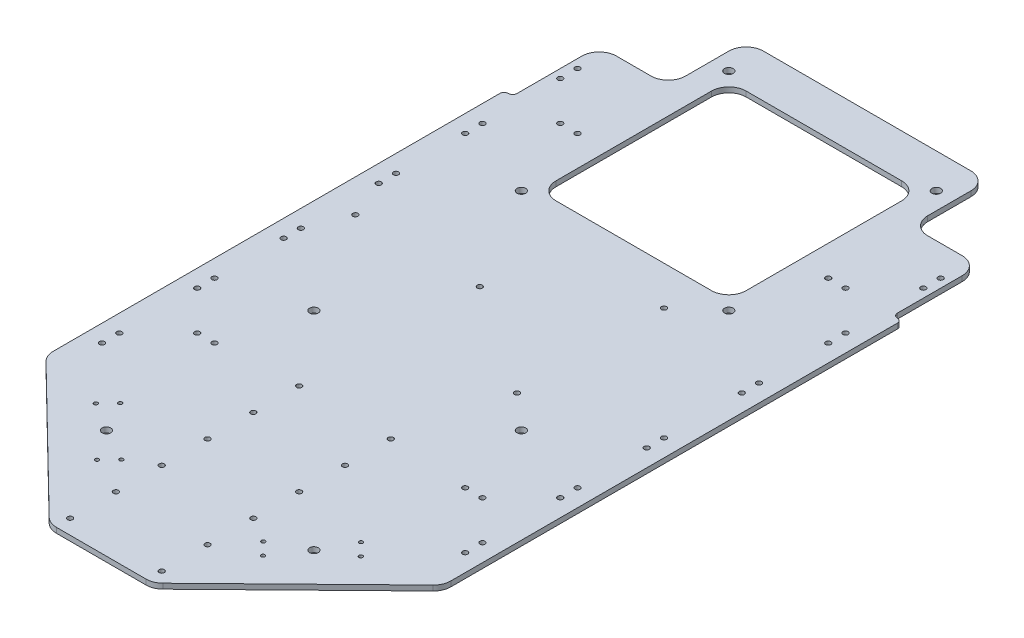
from build123d import *

# Parameters (mm, degrees)
SKETCH_1_W            = 230
SKETCH_1_H            = 400
SKETCH_1_R            = 2.5
EXTRUDE_1_DEPTH       = 3
SKETCH1_R             = 1.5
TOWER_HOLES_DEPTH     = 231.724944469
CUT_EXTRUDE2_DEPTH    = 7
SKETCH3_W             = 110
SKETCH3_H             = 110
CUT_EXTRUDE3_DEPTH    = 231.724944469
FILLET1_R             = 10
FILLET2_R             = 10
SKETCH4_W             = 200
SKETCH4_H             = 43
BOSS_EXTRUDE1_DEPTH   = 3
SKETCH5_R             = 1.5
CUT_EXTRUDE4_DEPTH    = 269.854979496
CUT_EXTRUDE5_DEPTH    = 269.854979496
FILLET3_R             = 10
FILLET4_R             = 2.5
SKETCH7_R             = 1.1
CUT_EXTRUDE6_DEPTH    = 269.854979496
SKETCH8_R             = 1.5
CUT_EXTRUDE7_DEPTH    = 269.854979496
SKETCH9_R             = 1.5
NUC_HOLES_DEPTH       = 269.854979496
SKETCH10_R            = 1.5
LIDAR_BOX_HOLES_DEPTH = 269.854979496


with BuildPart() as part:
    # Эскиз1 → Бобышка-Вытянуть1 (new body)
    with BuildSketch(Plane(origin=(0, 0, 0), x_dir=(1, 0, 0), z_dir=(0, 1, 0))):
        Rectangle(SKETCH_1_W, SKETCH_1_H)
        with Locations(Location((-60, -180, 0), (0, 0, 270))):
            Circle(SKETCH_1_R, mode=Mode.SUBTRACT)
        with Locations(Location((60, -180, 0), (0, 0, 90))):
            Circle(SKETCH_1_R, mode=Mode.SUBTRACT)
        with Locations(Location((60, -60, 0), (0, 0, 270))):
            Circle(SKETCH_1_R, mode=Mode.SUBTRACT)
        with Locations(Location((-60, -60, 0), (0, 0, 90))):
            Circle(SKETCH_1_R, mode=Mode.SUBTRACT)
        with Locations(Location((-60, 180, 0), (0, 0, 90))):
            Circle(SKETCH_1_R, mode=Mode.SUBTRACT)
        with Locations(Location((60, 180, 0), (0, 0, 270))):
            Circle(SKETCH_1_R, mode=Mode.SUBTRACT)
        with Locations(Location((60, 60, 0), (0, 0, 90))):
            Circle(SKETCH_1_R, mode=Mode.SUBTRACT)
        with Locations(Location((-60, 60, 0), (0, 0, 270))):
            Circle(SKETCH_1_R, mode=Mode.SUBTRACT)
    extrude(amount=EXTRUDE_1_DEPTH)

    # Sketch1 → Tower holes (cut, through all)
    with BuildSketch(Plane(origin=(0, 3, 0), x_dir=(1, 0, 0), z_dir=(0, 1, 0))):
        with Locations(Location((-105, 82.5, 0), (0, 0, 270))):
            Circle(SKETCH1_R)
        with Locations(Location((-105, 72.5, 0), (0, 0, 270))):
            Circle(SKETCH1_R)
        with Locations(Location((-82.5, 105, 0), (0, 0, 90))):
            Circle(SKETCH1_R)
        with Locations(Location((-72.5, 105, 0), (0, 0, 90))):
            Circle(SKETCH1_R)
        with Locations(Location((82.5, 105, 0), (0, 0, 270))):
            Circle(SKETCH1_R)
        with Locations(Location((72.5, 105, 0), (0, 0, 270))):
            Circle(SKETCH1_R)
        with Locations(Location((105, 82.5, 0), (0, 0, 90))):
            Circle(SKETCH1_R)
        with Locations(Location((105, 72.5, 0), (0, 0, 90))):
            Circle(SKETCH1_R)
        with Locations(Location((105, -82.5, 0), (0, 0, 270))):
            Circle(SKETCH1_R)
        with Locations(Location((105, -72.5, 0), (0, 0, 270))):
            Circle(SKETCH1_R)
        with Locations(Location((82.5, -105, 0), (0, 0, 90))):
            Circle(SKETCH1_R)
        with Locations(Location((72.5, -105, 0), (0, 0, 90))):
            Circle(SKETCH1_R)
        with Locations(Location((-82.5, -105, 0), (0, 0, 270))):
            Circle(SKETCH1_R)
        with Locations(Location((-72.5, -105, 0), (0, 0, 270))):
            Circle(SKETCH1_R)
        with Locations(Location((-105, -82.5, 0), (0, 0, 90))):
            Circle(SKETCH1_R)
        with Locations(Location((-105, -72.5, 0), (0, 0, 90))):
            Circle(SKETCH1_R)
        with Locations(Location((-105, 137.5, 0), (0, 0, 90))):
            Circle(SKETCH1_R)
        with Locations(Location((-105, 127.5, 0), (0, 0, 90))):
            Circle(SKETCH1_R)
        with Locations(Location((105, 127.5, 0), (0, 0, 270))):
            Circle(SKETCH1_R)
        with Locations(Location((105, 137.5, 0), (0, 0, 270))):
            Circle(SKETCH1_R)
        with Locations(Location((105, -127.5, 0), (0, 0, 90))):
            Circle(SKETCH1_R)
        with Locations(Location((105, -137.5, 0), (0, 0, 90))):
            Circle(SKETCH1_R)
        with Locations(Location((-105, -127.5, 0), (0, 0, 270))):
            Circle(SKETCH1_R)
        with Locations(Location((-105, -137.5, 0), (0, 0, 270))):
            Circle(SKETCH1_R)
    extrude(amount=-TOWER_HOLES_DEPTH, mode=Mode.SUBTRACT)

    # Sketch2 → Cut-Extrude2 (cut)
    with BuildSketch(Plane(origin=(0, 3, 0), x_dir=(1, 0, 0), z_dir=(0, 1, 0))):
        Polygon((-115, 200), (-70, 200), (-70, 155), (-110, 155), (-110, 105), (-115, 105), (-115, 155), align=None)
        Polygon((70, 200), (70, 155), (110, 155), (110, 105), (115, 105), (115, 155), (115, 200), align=None)
    extrude(amount=-CUT_EXTRUDE2_DEPTH, mode=Mode.SUBTRACT)

    # Sketch3 → Cut-Extrude3 (cut, through all)
    with BuildSketch(Plane(origin=(0, 3, 0), x_dir=(1, 0, 0), z_dir=(0, 1, 0))):
        with Locations((0, 120)):
            Rectangle(SKETCH3_W, SKETCH3_H)
    extrude(amount=-CUT_EXTRUDE3_DEPTH, mode=Mode.SUBTRACT)

    # Fillet1
    fillet1_edges = [part.edges().sort_by_distance(p)[0] for p in [
        (-55, 1.5, -65),
        (-55, 1.5, -175),
        (55, 1.5, -175),
        (55, 1.5, -65),
    ]]
    fillet(fillet1_edges, radius=FILLET1_R)

    # Fillet2
    fillet2_edges = [part.edges().sort_by_distance(p)[0] for p in [
        (70, 1.5, -200),
        (-70, 1.5, -200),
        (-70, 1.5, -155),
        (-110, 1.5, -155),
        (110, 1.5, -155),
        (70, 1.5, -155),
    ]]
    fillet(fillet2_edges, radius=FILLET2_R)

    # Sketch4 → Boss-Extrude1 (add)
    with BuildSketch(Plane(origin=(0, 0, 0), x_dir=(1, 0, 0), z_dir=(0, 1, 0))):
        with Locations((0, -221.5)):
            Rectangle(SKETCH4_W, SKETCH4_H)
    extrude(amount=BOSS_EXTRUDE1_DEPTH)

    # Sketch5 → Cut-Extrude4 (cut, through all)
    with BuildSketch(Plane(origin=(0, 3, 0), x_dir=(1, 0, 0), z_dir=(0, 1, 0))):
        with Locations(Location((26.5, -208, 0), (0, 0, 270))):
            Circle(SKETCH5_R)
        with Locations(Location((-26.5, -208, 0), (0, 0, 90))):
            Circle(SKETCH5_R)
        with Locations(Location((26.5, -234.5, 0), (0, 0, 270))):
            Circle(SKETCH5_R)
        with Locations(Location((-26.5, -234.5, 0), (0, 0, 90))):
            Circle(SKETCH5_R)
        with Locations(Location((26.5, -181.5, 0), (0, 0, 270))):
            Circle(SKETCH5_R)
        with Locations(Location((-26.5, -181.5, 0), (0, 0, 90))):
            Circle(SKETCH5_R)
        with Locations(Location((26.5, -155, 0), (0, 0, 270))):
            Circle(SKETCH5_R)
        with Locations(Location((-26.5, -155, 0), (0, 0, 90))):
            Circle(SKETCH5_R)
        with Locations(Location((26.5, -128.5, 0), (0, 0, 270))):
            Circle(SKETCH5_R)
        with Locations(Location((-26.5, -128.5, 0), (0, 0, 90))):
            Circle(SKETCH5_R)
        with Locations(Location((26.5, -102, 0), (0, 0, 270))):
            Circle(SKETCH5_R)
        with Locations(Location((-26.5, -102, 0), (0, 0, 90))):
            Circle(SKETCH5_R)
    extrude(amount=-CUT_EXTRUDE4_DEPTH, mode=Mode.SUBTRACT)

    # Sketch6 → Cut-Extrude5 (cut, through all)
    with BuildSketch(Plane(origin=(0, 3, 0), x_dir=(1, 0, 0), z_dir=(0, 1, 0))):
        Polygon((115, -160), (30, -243), (115, -243), align=None)
        Polygon((-115, -160), (-30, -243), (-115, -243), align=None)
    extrude(amount=-CUT_EXTRUDE5_DEPTH, mode=Mode.SUBTRACT)

    # Fillet3
    fillet3_edges = [part.edges().sort_by_distance(p)[0] for p in [
        (115, 1.5, 160),
        (30, 1.5, 243),
        (-30, 1.5, 243),
        (-115, 1.5, 160),
    ]]
    fillet(fillet3_edges, radius=FILLET3_R)

    # Fillet4
    fillet4_edges = [part.edges().sort_by_distance(p)[0] for p in [
        (110, 1.5, -105),
        (-110, 1.5, -105),
    ]]
    fillet(fillet4_edges, radius=FILLET4_R)
    fillet4_2_edges = [part.edges().sort_by_distance(p)[0] for p in [
        (115, 1.5, -105),
        (-115, 1.5, -105),
    ]]
    fillet(fillet4_2_edges, radius=FILLET4_R - 0.0001)  # a hair under: the kernel refuses the full size

    # Sketch7 → Cut-Extrude6 (cut, through all)
    with BuildSketch(Plane(origin=(0, 3, 0), x_dir=(1, 0, 0), z_dir=(0, 1, 0))):
        with Locations(Location((41.027426882, -190.3, 0), (0, 0, 270))):
            Circle(SKETCH7_R)
        with Locations(Location((48.013820265, -197.454740212, 0), (0, 0, 90))):
            Circle(SKETCH7_R)
        with Locations(Location((76.632781112, -169.509166679, 0), (0, 0, 270))):
            Circle(SKETCH7_R)
        with Locations(Location((69.646387729, -162.354426467, 0), (0, 0, 90))):
            Circle(SKETCH7_R)
        with Locations(Location((-69.646387729, -162.354426467, 0), (0, 0, 270))):
            Circle(SKETCH7_R)
        with Locations(Location((-76.632781112, -169.509166679, 0), (0, 0, 90))):
            Circle(SKETCH7_R)
        with Locations(Location((-48.013820265, -197.454740212, 0), (0, 0, 270))):
            Circle(SKETCH7_R)
        with Locations(Location((-41.027426882, -190.3, 0), (0, 0, 90))):
            Circle(SKETCH7_R)
    extrude(amount=-CUT_EXTRUDE6_DEPTH, mode=Mode.SUBTRACT)

    # Sketch8 → Cut-Extrude7 (cut, through all)
    with BuildSketch(Plane(origin=(0, 3, 0), x_dir=(1, 0, 0), z_dir=(0, 1, 0))):
        with Locations(Location((105, -32.5, 0), (0, 0, 270))):
            Circle(SKETCH8_R)
        with Locations(Location((105, -22.5, 0), (0, 0, 90))):
            Circle(SKETCH8_R)
        with Locations(Location((105, 22.5, 0), (0, 0, 270))):
            Circle(SKETCH8_R)
        with Locations(Location((105, 32.5, 0), (0, 0, 90))):
            Circle(SKETCH8_R)
        with Locations(Location((-105, 32.5, 0), (0, 0, 270))):
            Circle(SKETCH8_R)
        with Locations(Location((-105, 22.5, 0), (0, 0, 90))):
            Circle(SKETCH8_R)
        with Locations(Location((-105, -22.5, 0), (0, 0, 270))):
            Circle(SKETCH8_R)
        with Locations(Location((-105, -32.5, 0), (0, 0, 90))):
            Circle(SKETCH8_R)
    extrude(amount=-CUT_EXTRUDE7_DEPTH, mode=Mode.SUBTRACT)

    # Sketch9 → NUC holes (cut, through all)
    with BuildSketch(Plane(origin=(0, 3, 0), x_dir=(1, 0, 0), z_dir=(0, 1, 0))):
        with Locations(Location((40, 42.5, 0), (0, 0, 270))):
            Circle(SKETCH9_R)
        with Locations(Location((40, -42.5, 0), (0, 0, 90))):
            Circle(SKETCH9_R)
    extrude(amount=-NUC_HOLES_DEPTH, mode=Mode.SUBTRACT)

    # Sketch10 → Lidar box holes (cut, through all)
    with BuildSketch(Plane(origin=(0, 3, 0), x_dir=(1, 0, 0), z_dir=(0, 1, 0))):
        with Locations(Location((-96, 0, 0), (0, 0, 270))):
            Circle(SKETCH10_R)
        with Locations(Location((-24, 0, 0), (0, 0, 90))):
            Circle(SKETCH10_R)
    extrude(amount=-LIDAR_BOX_HOLES_DEPTH, mode=Mode.SUBTRACT)


solid = part.part
